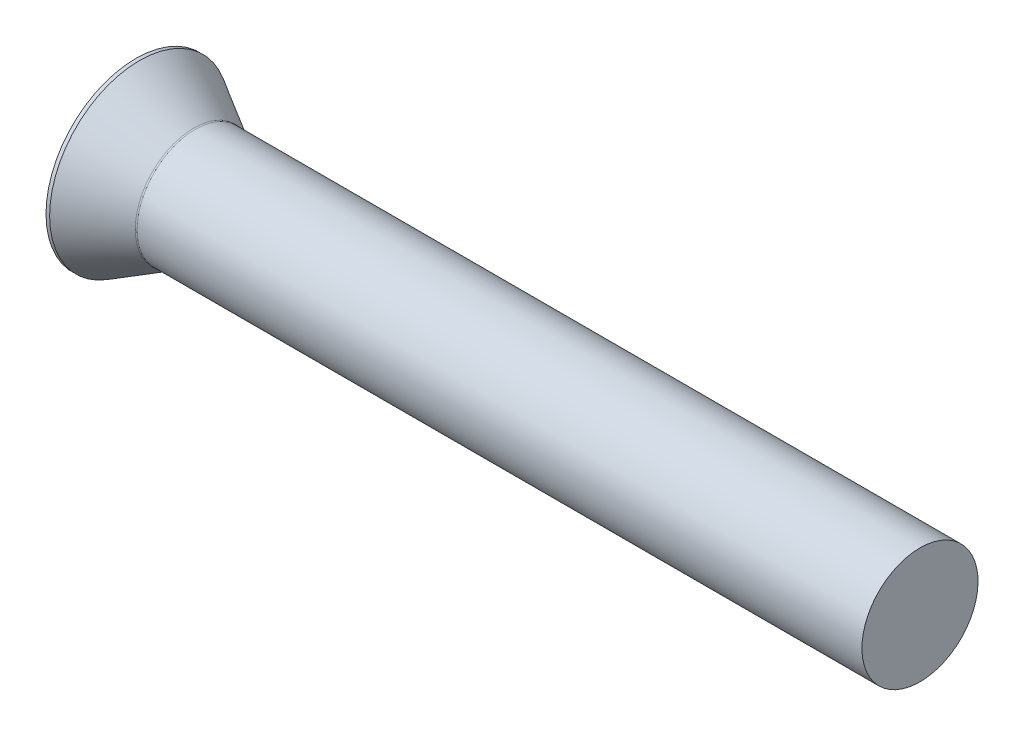
from build123d import *

# Parameters (mm, degrees)
SKETCH2_R      = 8
BASEBODY_DEPTH = 100
FILLET1_R      = 0.4


with BuildPart() as part:
    # Sketch3 → BaseHead (revolve)
    with BuildSketch(Plane(origin=(19.468089614, 10.942012198, 0), x_dir=(0, 1, 0), z_dir=(0, 0, 1))):
        with BuildLine():
            Line((-2.942012198, 8.068089614), (-10.942012198, 8.068089614))
            Line((-10.942012198, 8.068089614), (-10.942012198, 19.468089614))
            ThreePointArc((-10.942012198, 19.468089614), (-4.535561709, 18.622803868), (1.432404466, 16.144801528))
            Line((1.432404466, 16.144801528), (1.432404466, 15.644801528))
            Line((1.432404466, 15.644801528), (-2.942012198, 8.068089614))
        make_face()
    revolve(axis=Axis((-11.021250522, 0, 0), (1, 0, 0)))

    # Sketch2 → BaseBody (add)
    with BuildSketch(Plane(origin=(11.4, 0.108124932, -0.559152549), x_dir=(0, 0, -1), z_dir=(1, 0, 0))):
        with Locations((-0.559152549, -0.108124932)):
            Circle(SKETCH2_R)
    extrude(amount=BASEBODY_DEPTH)

    # Fillet1
    fillet1_edges = [part.edges().sort_by_distance(p)[0] for p in [
        (11.4, -5.656854249, 5.656854249),
    ]]
    fillet(fillet1_edges, radius=FILLET1_R)


solid = part.part
